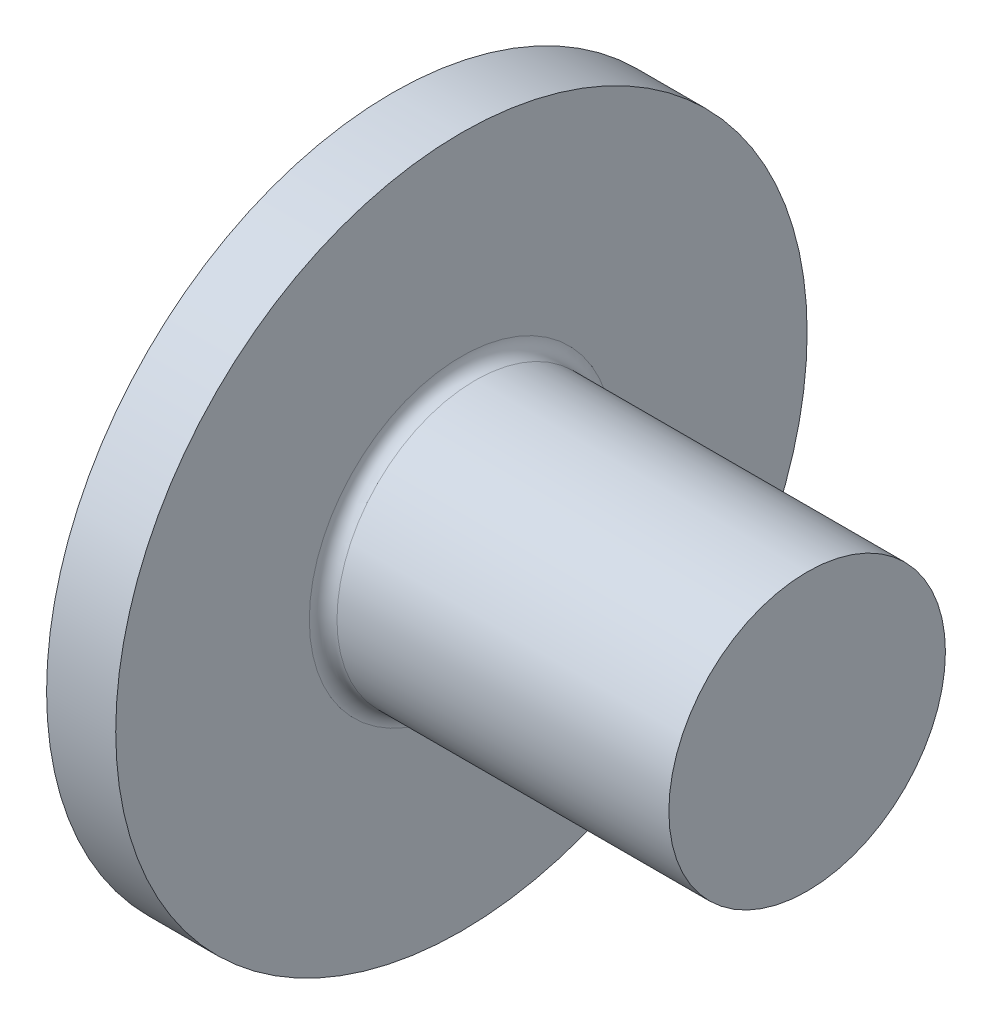
from build123d import *

# Parameters (mm, degrees)
RECPAT_COUNT = 2
RECPAT_ANGLE = 90


with BuildPart() as part:
    # Fillet1: read off the stored shape, not the designer's step
    # Fillet1 outline → Fillet1 (revolve)
    with BuildSketch(Plane.YX):
        with BuildLine():
            Line((2, 3.25), (2, 8.05))
            Line((2, 8.05), (0, 8.05))
            Line((0, 8.05), (0, 2.05))
            Line((0, 2.05), (5, 2.05))
            Line((5, 2.05), (5, 3.05))
            Line((5, 3.05), (2.2, 3.05))
            ThreePointArc((2.2, 3.05), (2.058578644, 3.108578644), (2, 3.25))
        make_face()
    revolve(axis=Axis((0, 0, 0), (1, 0, 0)))

    # PanSke → Pan (revolve)
    with BuildSketch(Plane.XY, mode=Mode.PRIVATE) as pan_sk:
        with BuildLine():
            Line((2.05, 4.424646879), (2.05, 0))
            Line((2.05, 0), (0, 0))
            ThreePointArc((0, 0), (0.537396082, 2.438237068), (2.05, 4.424646879))
        make_face()
    revolve(pan_sk.sketch.rotate(Axis((0, 0, 0), (1, 0, 0)), 90), axis=Axis((0, 0, 0), (1, 0, 0)))

    # Sketch3 → Recess section 0
    with BuildSketch(Plane(origin=(0, 0, 0), x_dir=(0, 0, -1), z_dir=(1, 0, 0))):
        with BuildLine():
            Line((-0.515, 2.15), (0.515, 2.15))
            Line((0.515, 2.15), (0.515, -2.15))
            Line((0.515, -2.15), (-0.515, -2.15))
            Line((-0.515, -2.15), (-0.515, 2.15))
        make_face()
    # Sketch4 → Recess section 1
    with BuildSketch(Plane(origin=(2.34, 0, 0), x_dir=(0, 0, -1), z_dir=(1, 0, 0))):
        with BuildLine():
            Line((-0.515, 2.106524682), (0.515, 2.106524682))
            Line((0.515, 2.106524682), (0.515, -2.106524682))
            Line((0.515, -2.106524682), (-0.515, -2.106524682))
            Line((-0.515, -2.106524682), (-0.515, 2.106524682))
        make_face()
    recess = loft(mode=Mode.SUBTRACT)

    # RecPat: Recess ×2 about axis
    recpat_axis = Axis((0, 0, 0), (1, 0, 0))
    for i in range(1, RECPAT_COUNT):
        add(recess.rotate(recpat_axis, i * RECPAT_ANGLE / (RECPAT_COUNT - 1)), mode=Mode.SUBTRACT)

    # RecCorSke → RecessCore (revolve, cut)
    with BuildSketch(Plane.XY, mode=Mode.PRIVATE) as recesscore_sk:
        Polygon((0, 0), (0, 1.172663335), (4.6, 0.851), (4.876506661, 0), align=None)
    revolve(recesscore_sk.sketch.rotate(Axis((-3.175, 0, 0), (1, 0, 0)), 90), axis=Axis((-3.175, 0, 0), (1, 0, 0)), mode=Mode.SUBTRACT)


solid = part.part
